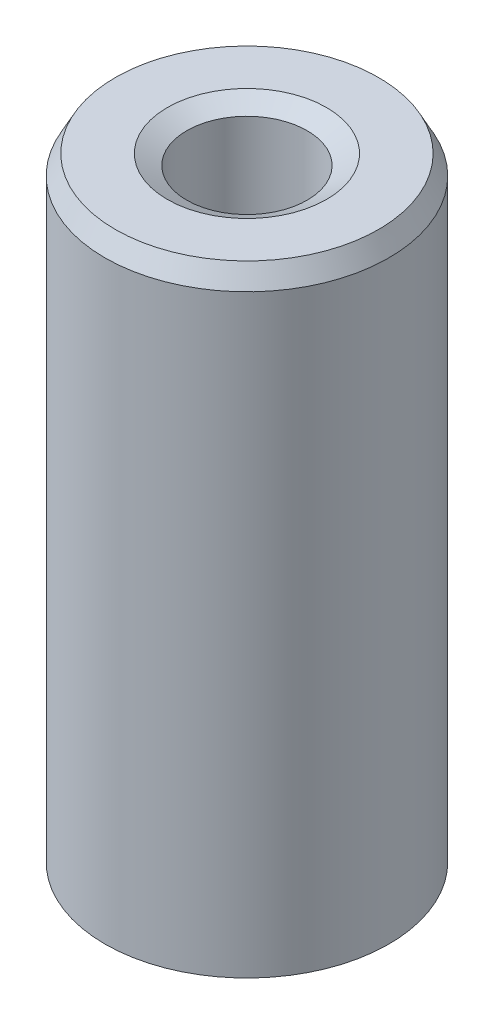
from build123d import *
from OCP.BRepFilletAPI import BRepFilletAPI_MakeChamfer

# Parameters (mm, degrees)
SKETCH1_R           = 7.5
BOSS_EXTRUDE1_DEPTH = 32.964177129
SKETCH2_R           = 3.18165002
CUT_EXTRUDE1_DEPTH  = 35.628557201
CHAMFER1_SIZE       = 1.025249526
CHAMFER1_SIZE2      = 0.545814562


with BuildPart() as part:
    # Sketch1 → Boss-Extrude1 (new body)
    with BuildSketch(Plane(origin=(0, 0, 0), x_dir=(1, 0, 0), z_dir=(0, 1, 0))):
        Circle(SKETCH1_R)
    extrude(amount=BOSS_EXTRUDE1_DEPTH)

    # Sketch2 → Cut-Extrude1 (cut, through all)
    with BuildSketch(Plane(origin=(0, 0, 0), x_dir=(1, 0, 0), z_dir=(0, 1, 0))):
        Circle(SKETCH2_R)
    extrude(amount=CUT_EXTRUDE1_DEPTH, mode=Mode.SUBTRACT)

    # Chamfer1: one chamfer whose edges measure the first distance from different faces: ONE call of the kernel's chamfer builder (chamfer() names one face for all edges)
    chamfer1_edges_1 = [part.edges().sort_by_distance(p)[0] for p in [
        (-3.18165002, 32.964177129, 0),
    ]]
    chamfer1_side_1 = [part.faces().sort_by_distance(p)[0] for p in [
        (-7.287867966, 32.964177129, 0),
    ]]
    chamfer1_edges_2 = [part.edges().sort_by_distance(p)[0] for p in [
        (-3.18165002, 0, 0),
    ]]
    chamfer1_side_2 = [part.faces().sort_by_distance(p)[0] for p in [
        (-3.18165002, 16.482088564, 0),
    ]]
    chamfer1_edges_3 = [part.edges().sort_by_distance(p)[0] for p in [
        (-7.5, 0, 0),
    ]]
    chamfer1_side_3 = [part.faces().sort_by_distance(p)[0] for p in [
        (-7.287867966, 0, 0),
    ]]
    chamfer1_edges_4 = [part.edges().sort_by_distance(p)[0] for p in [
        (-7.5, 32.964177129, 0),
    ]]
    chamfer1_side_4 = [part.faces().sort_by_distance(p)[0] for p in [
        (-7.5, 16.482088564, 0),
    ]]
    chamfer1 = BRepFilletAPI_MakeChamfer(part.part.solid().wrapped)
    for e in chamfer1_edges_1:
        chamfer1.Add(CHAMFER1_SIZE, CHAMFER1_SIZE2, e.wrapped, chamfer1_side_1[0].wrapped)  # the first distance lies on this face
    for e in chamfer1_edges_2:
        chamfer1.Add(CHAMFER1_SIZE, CHAMFER1_SIZE2, e.wrapped, chamfer1_side_2[0].wrapped)  # the first distance lies on this face
    for e in chamfer1_edges_3:
        chamfer1.Add(CHAMFER1_SIZE, CHAMFER1_SIZE2, e.wrapped, chamfer1_side_3[0].wrapped)  # the first distance lies on this face
    for e in chamfer1_edges_4:
        chamfer1.Add(CHAMFER1_SIZE, CHAMFER1_SIZE2, e.wrapped, chamfer1_side_4[0].wrapped)  # the first distance lies on this face
    add(Compound.cast(chamfer1.Shape()), mode=Mode.REPLACE)


solid = part.part
